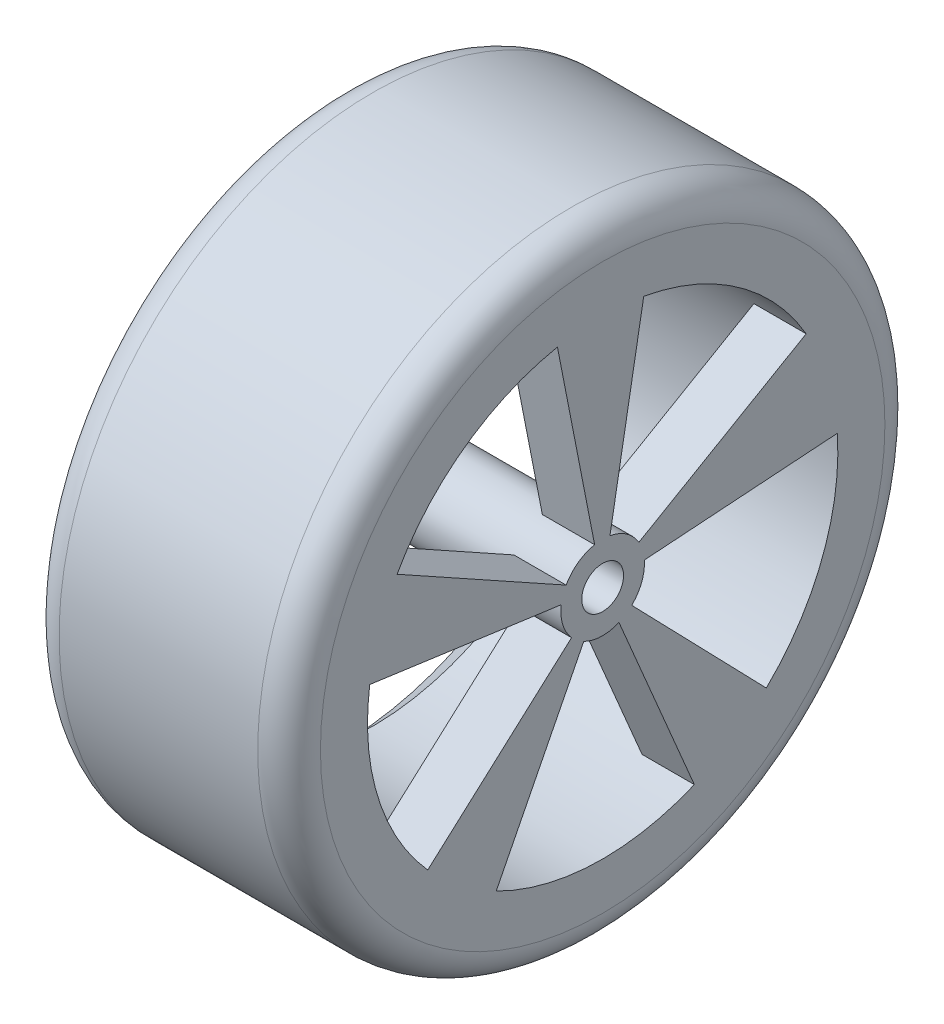
from build123d import *

# Parameters (mm, degrees)
SKETCH1_R           = 30
BOSS_EXTRUDE1_DEPTH = 25
FILLET1_R           = 3
SKETCH3_R           = 22.5
CUT_EXTRUDE1_DEPTH  = 20
CHAMFER1_SIZE       = 3
CUT_EXTRUDE2_DEPTH  = 50.244289
CIRPATTERN1_COUNT   = 5
CIRPATTERN1_ANGLE   = 284
SKETCH4_R           = 4
BOSS_EXTRUDE2_DEPTH = 15
SKETCH5_R           = 2
CUT_EXTRUDE3_DEPTH  = 47.904158


with BuildPart() as part:
    # Sketch1 → Boss-Extrude1 (new body)
    with BuildSketch(Plane(origin=(0, 0, 0), x_dir=(0, 0, -1), z_dir=(1, 0, 0))):
        Circle(SKETCH1_R)
    extrude(amount=BOSS_EXTRUDE1_DEPTH)

    # Fillet1
    fillet1_edges = [part.edges().sort_by_distance(p)[0] for p in [
        (0, 0, 30),
        (25, 0, 30),
    ]]
    fillet(fillet1_edges, radius=FILLET1_R)

    # Sketch3 → Cut-Extrude1 (cut)
    with BuildSketch(Plane.ZY):
        Circle(SKETCH3_R)
    extrude(amount=-CUT_EXTRUDE1_DEPTH, mode=Mode.SUBTRACT)

    # Chamfer1
    chamfer1_edges = [part.edges().sort_by_distance(p)[0] for p in [
        (0, 0, -22.5),
    ]]
    chamfer(chamfer1_edges, length=CHAMFER1_SIZE)

    # Sketch2 → Cut-Extrude2 (cut, through all)
    with BuildSketch(Plane.ZY.offset(-25)):
        with BuildLine():
            Line((-0.698388, 3.93856), (-3.92843, 22.1544))
            ThreePointArc((-3.92843, 22.1544), (-12.900017, 18.434738), (-19.468054, 11.280288))
            Line((-19.468054, 11.280288), (-3.460987, 2.005384))
            ThreePointArc((-3.460987, 2.005384), (-2.293336, 3.277287), (-0.698388, 3.93856))
        make_face()
    cut_extrude2 = extrude(amount=CUT_EXTRUDE2_DEPTH, mode=Mode.SUBTRACT)

    # CirPattern1: Cut-Extrude2 ×5 about axis
    cirpattern1_axis = Axis((25, 0, 0), (1, 0, 0))
    for i in range(1, CIRPATTERN1_COUNT):
        add(cut_extrude2.rotate(cirpattern1_axis, i * CIRPATTERN1_ANGLE / (CIRPATTERN1_COUNT - 1)), mode=Mode.SUBTRACT)

    # Sketch4 → Boss-Extrude2 (add)
    with BuildSketch(Plane.ZY.offset(-20)):
        Circle(SKETCH4_R)
    extrude(amount=BOSS_EXTRUDE2_DEPTH)

    # Sketch5 → Cut-Extrude3 (cut, through all)
    with BuildSketch(Plane.ZY.offset(-5)):
        Circle(SKETCH5_R)
    extrude(amount=-CUT_EXTRUDE3_DEPTH, mode=Mode.SUBTRACT)


solid = part.part
